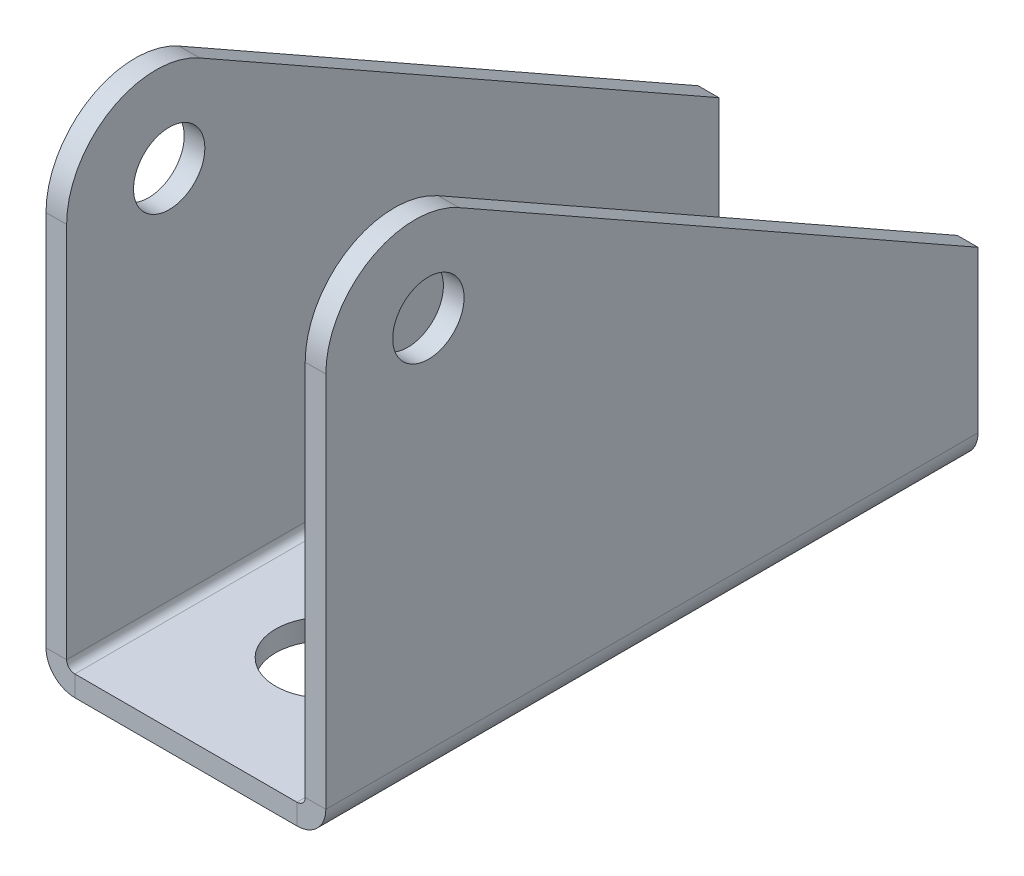
from build123d import *

# Parameters (mm, degrees)
BASE_FLANGE1_START = -58.5
BASE_FLANGE1_DEPTH = 58.5
SKETCH7_R          = 3.2
CUT_EXTRUDE1_DEPTH = 75.505788366
SKETCH8_R          = 4.45
CUT_EXTRUDE2_DEPTH = 75.505788366


# Read off the part's stored shape, not the designer's step: Base-Flange1
with BuildPart() as part:
    # Base-Flange1 outline → Base-Flange1 (new body)
    with BuildSketch(Plane.XY.offset(BASE_FLANGE1_START)):
        with BuildLine():
            ThreePointArc((9.9634, 0), (11.7924024, 0.7575976), (12.55, 2.5866))
            Line((12.55, 2.5866), (12.55, 44.4))
            Line((12.55, 44.4), (10.7, 44.4))
            Line((10.7, 44.4), (10.7, 2.5866))
            ThreePointArc((10.7, 2.5866), (10.484254855, 2.065745145), (9.9634, 1.85))
            Line((9.9634, 1.85), (0, 1.85))
            Line((0, 1.85), (0, 0))
            Line((0, 0), (9.9634, 0))
        make_face()
    extrude(amount=BASE_FLANGE1_DEPTH)

    # Sketch7 → Cut-Extrude1 (cut, through all)
    with BuildSketch(Plane(origin=(0, 0, 0), x_dir=(0, 0, -1), z_dir=(1, 0, 0))):
        with BuildLine():
            Line((11.941667032, 43.361555933), (58.5, 17))
            Line((58.5, 17), (58.5, 44.4))
            Line((58.5, 44.4), (8, 44.4))
            ThreePointArc((8, 44.4), (10.038081516, 44.136034109), (11.941667032, 43.361555933))
        make_face()
        with BuildLine():
            ThreePointArc((0, 36.4), (2.343145751, 42.056854249), (8, 44.4))
            Line((8, 44.4), (0, 44.4))
            Line((0, 44.4), (0, 36.4))
        make_face()
        with Locations((9.2, 36.15)):
            Circle(SKETCH7_R)
    extrude(amount=CUT_EXTRUDE1_DEPTH, mode=Mode.SUBTRACT)

    # Sketch8 → Cut-Extrude2 (cut, through all)
    with BuildSketch(Plane(origin=(0, 0, 0), x_dir=(1, 0, 0), z_dir=(0, 1, 0))):
        with Locations((0, 12.5)):
            Circle(SKETCH8_R)
        with BuildLine():
            Line((-5.05, 49.4), (-5.05, 58.5))
            ThreePointArc((-5.05, 58.5), (0, 63.55), (5.05, 58.5))
            Line((5.05, 58.5), (5.05, 49.4))
            ThreePointArc((5.05, 49.4), (0, 44.35), (-5.05, 49.4))
        make_face()
    extrude(amount=CUT_EXTRUDE2_DEPTH, mode=Mode.SUBTRACT)

    # Mirror1: part across plane


with BuildPart() as part_1:
    add(part.part)
    add(part.part.mirror(Plane(origin=(0, 0, -58.5), x_dir=(0, 0, 1), z_dir=(1, 0, 0))))


solid = part_1.part
